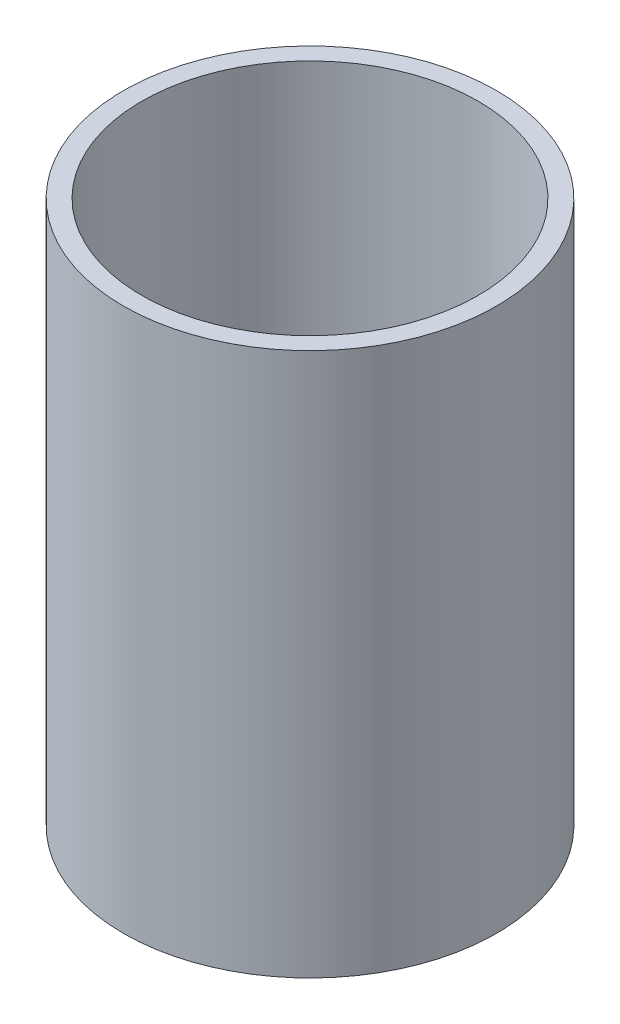
from build123d import *

# Parameters (mm, degrees)
SKETCH1_R           = 42.5
BOSS_EXTRUDE1_DEPTH = 123.750590233
SKETCH2_R           = 38.326340889
CUT_EXTRUDE1_DEPTH  = 138.574374732


with BuildPart() as part:
    # Sketch1 → Boss-Extrude1 (new body)
    with BuildSketch(Plane(origin=(0, 0, 0), x_dir=(1, 0, 0), z_dir=(0, 1, 0))):
        Circle(SKETCH1_R)
    extrude(amount=BOSS_EXTRUDE1_DEPTH)

    # Sketch2 → Cut-Extrude1 (cut, through all)
    with BuildSketch(Plane(origin=(0, 0, 0), x_dir=(1, 0, 0), z_dir=(0, 1, 0))):
        Circle(SKETCH2_R)
    extrude(amount=CUT_EXTRUDE1_DEPTH, mode=Mode.SUBTRACT)


solid = part.part
